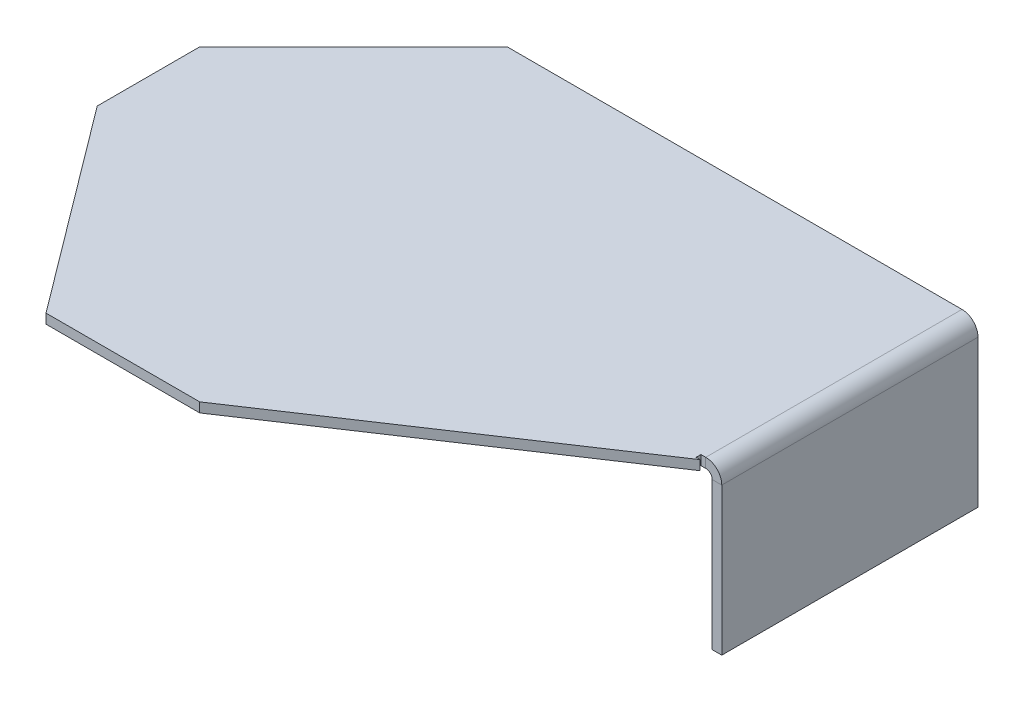
from build123d import *

# Parameters (mm, degrees)
BASE_FLANGE1_DEPTH            = 9.525
EDGE_FLANGE1_STRIP_W          = 50.8508
EDGE_FLANGE1_STRIP_H          = 9.525
EDGE_FLANGE1_STRIP_CUT_DEPTH  = 254
EDGE_FLANGE1_RELIEF_W         = 55.6133
EDGE_FLANGE1_RELIEF_H         = 4.7625
EDGE_FLANGE1_RELIEF_CUT_DEPTH = 9.525
EDGE_FLANGE1_DEPTH            = 254


# Sheet-metal steps are written as plain solids
with BuildPart() as part:
    # Sketch1 → Base-Flange1 (new body)
    with BuildSketch(Plane(origin=(0, 0, 0), x_dir=(1, 0, 0), z_dir=(0, 1, 0))):
        Polygon((304.8, 50.8), (304.8, 203.2), (-152.4, 203.2), (-304.8, 50.8), (-304.8, -50.8), (-152.4, -254), (0, -254), (304.8, -50.8), align=None)
    extrude(amount=-BASE_FLANGE1_DEPTH)

    # Edge-Flange1 strip (across the edge) → Edge-Flange1 strip cut (cut)
    with BuildSketch(Plane(origin=(304.8, -9.525, -203.2), x_dir=(-1, 0, 0), z_dir=(0, 0, 1))):
        with Locations((-19.05, -4.7625)):
            Rectangle(EDGE_FLANGE1_STRIP_W, EDGE_FLANGE1_STRIP_H)
    extrude(amount=EDGE_FLANGE1_STRIP_CUT_DEPTH, mode=Mode.SUBTRACT)

    # Edge-Flange1 relief (on the sheet) → Edge-Flange1 relief cut (cut)
    with BuildSketch(Plane(origin=(298.4246, -9.525, -203.2), x_dir=(-1, 0, 0), z_dir=(0, -1, 0))):
        with Locations((-23.04415, -256.38125)):
            Rectangle(EDGE_FLANGE1_RELIEF_W, EDGE_FLANGE1_RELIEF_H)
    extrude(amount=-EDGE_FLANGE1_RELIEF_CUT_DEPTH, mode=Mode.SUBTRACT)

    # Edge-Flange1 section (across the edge) → Edge-Flange1 (add)
    with BuildSketch(Plane(origin=(304.8, -9.525, -203.2), x_dir=(-1, 0, 0), z_dir=(0, 0, 1))):
        with BuildLine():
            Line((-9.525, 6.3754), (-9.525, 152.4))
            Line((-9.525, 152.4), (0, 152.4))
            Line((0, 152.4), (0, 6.3754))
            ThreePointArc((0, 6.3754), (1.867311427, 1.867311427), (6.3754, 0))
            Line((6.3754, 0), (6.3754, -9.525))
            ThreePointArc((6.3754, -9.525), (-4.867880664, -4.867880664), (-9.525, 6.3754))
        make_face()
    extrude(amount=EDGE_FLANGE1_DEPTH)


solid = part.part
